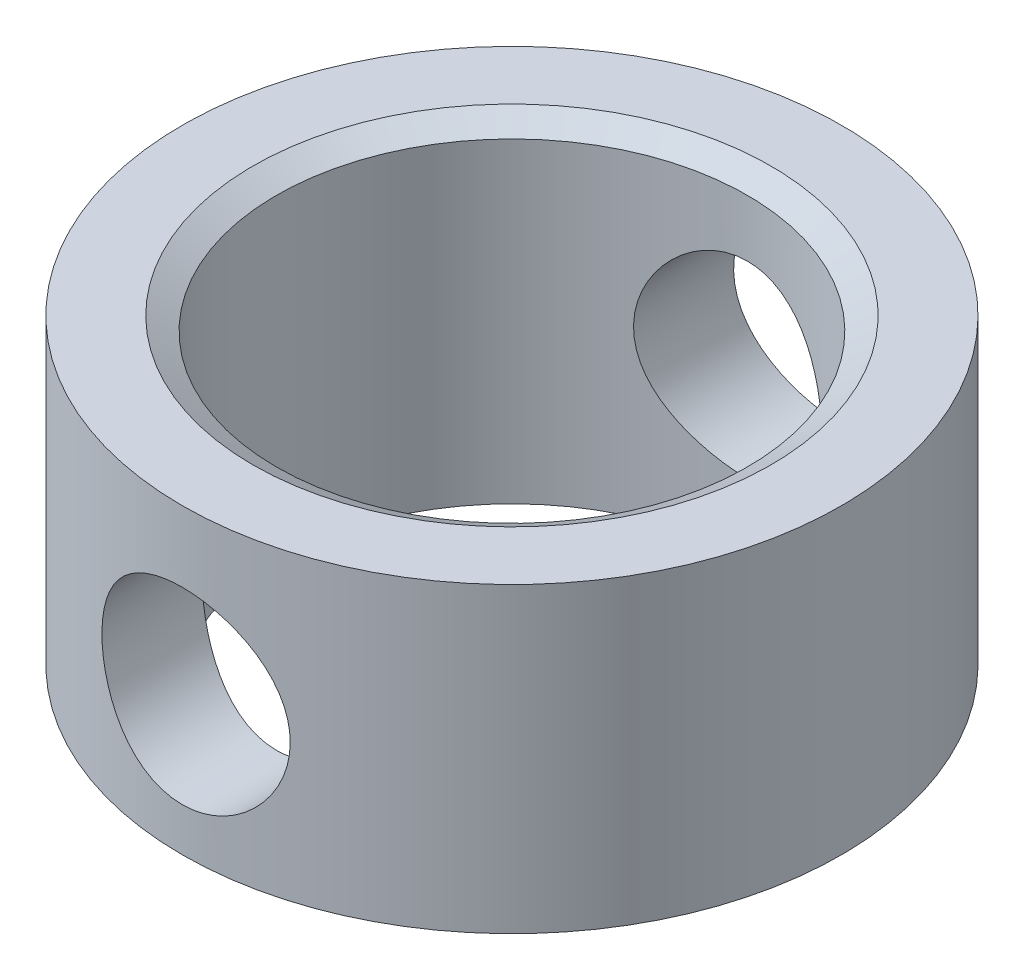
from build123d import *

# Parameters (mm, degrees)
SKETCH1_R               = 7
SKETCH1_R_2             = 5
BOSS_EXTRUDE1_DEPTH     = 7
CHAMFER1_SIZE           = 0.5
CHAMFER1_SIZE2          = 0.288675135
CHAMFER2_SIZE           = 1
CHAMFER2_SIZE2          = 0.577350269
CUT_EXTRUDE1_DEPTH      = 13.124355653
CUT_EXTRUDE1_DEPTH_BACK = 13.124355653
SKETCH2_R               = 2


with BuildPart() as part:
    # Sketch1 → Boss-Extrude1 (new body)
    with BuildSketch(Plane(origin=(0, 0, 0), x_dir=(1, 0, 0), z_dir=(0, 1, 0))):
        Circle(SKETCH1_R)
        Circle(SKETCH1_R_2, mode=Mode.SUBTRACT)
    extrude(amount=BOSS_EXTRUDE1_DEPTH)

    # Chamfer1
    chamfer1_edges = [part.edges().sort_by_distance(p)[0] for p in [
        (-5, 7, 0),
    ]]
    chamfer1_side = [part.faces().sort_by_distance(p)[0] for p in [
        (-6.802010101, 7, 0),
    ]]
    chamfer(chamfer1_edges, length=CHAMFER1_SIZE, length2=CHAMFER1_SIZE2, reference=chamfer1_side[0])

    # Chamfer2
    chamfer2_edges = [part.edges().sort_by_distance(p)[0] for p in [
        (-7, 0, 0),
    ]]
    chamfer2_side = [part.faces().sort_by_distance(p)[0] for p in [
        (-6.802010101, 0, 0),
    ]]
    chamfer(chamfer2_edges, length=CHAMFER2_SIZE, length2=CHAMFER2_SIZE2, reference=chamfer2_side[0])

    # Sketch2 → Cut-Extrude1 (cut, two sides: drawn at the far end of the back side and taken through both)
    with BuildSketch(Plane.XY.offset(-CUT_EXTRUDE1_DEPTH_BACK)):
        with Locations((0, 3.5)):
            Circle(SKETCH2_R)
    extrude(amount=CUT_EXTRUDE1_DEPTH + CUT_EXTRUDE1_DEPTH_BACK, mode=Mode.SUBTRACT)


solid = part.part
